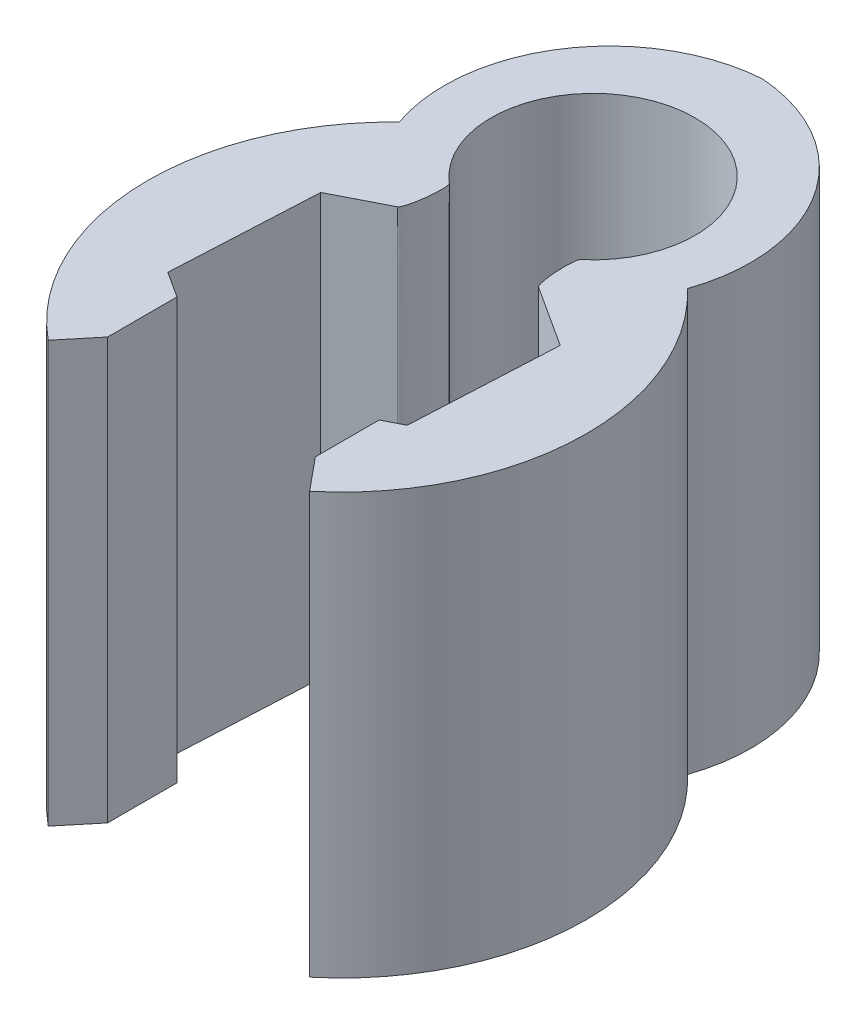
from build123d import *

# Parameters (mm, degrees)
BOSS_EXTRUDE1_DEPTH = 19.05


with BuildPart() as part:
    # Sketch3 → Boss-Extrude1 (new body)
    with BuildSketch(Plane(origin=(0, 0, 0), x_dir=(1, 0, 0), z_dir=(0, 1, 0))):
        with BuildLine():
            Line((-5.541525375, 3.58326618), (-2.47962532, 5.150959008))
            Line((-2.47962532, 5.150959008), (-2.47962532, 6.474170352))
            ThreePointArc((-2.47962532, 6.474170352), (-2.221563685, 14.417025562), (4.617359972, 10.369227654))
            ThreePointArc((4.617359972, 10.369227654), (4.047797908, 8.147663968), (2.47962532, 6.474170352))
            Line((2.47962532, 6.474170352), (2.47962532, 5.20231788))
            Line((2.47962532, 5.20231788), (5.873962228, 3.007468661))
            Line((5.873962228, 3.007468661), (5.541525375, -3.58326618))
            Line((5.541525375, -3.58326618), (4.701204968, -4.013510228))
            Line((4.701204968, -4.013510228), (4.701204968, -6.905610932))
            Line((4.701204968, -6.905610932), (5.918780254, -8.378526195))
            ThreePointArc((5.918780254, -8.378526195), (9.922634137, -0.265088751), (6.526624698, 8.120961152))
            ThreePointArc((6.526624698, 8.120961152), (5.706991897, 14.686716316), (0, 18.035026682))
            ThreePointArc((0, 18.035026682), (-5.706991897, 14.686716316), (-6.526624698, 8.120961152))
            ThreePointArc((-6.526624698, 8.120961152), (-9.922634137, -0.265088751), (-5.918780254, -8.378526195))
            Line((-5.918780254, -8.378526195), (-4.701204968, -6.905610932))
            Line((-4.701204968, -6.905610932), (-4.701204968, -3.765798027))
            Line((-4.701204968, -3.765798027), (-5.873962228, -3.007468661))
            Line((-5.873962228, -3.007468661), (-5.541525375, 3.58326618))
        make_face()
        with BuildLine():
            Line((-2.47962532, 6.474170352), (-2.47962532, 5.150959008))
            Line((-2.47962532, 5.150959008), (-1.063503338, 5.876013463))
            ThreePointArc((-1.063503338, 5.876013463), (-1.79663243, 6.115743784), (-2.47962532, 6.474170352))
        make_face()
        with BuildLine():
            ThreePointArc((2.47962532, 6.474170352), (1.921985685, 6.17089654), (1.328021538, 5.946968965))
            Line((1.328021538, 5.946968965), (2.47962532, 5.20231788))
            Line((2.47962532, 5.20231788), (2.47962532, 6.474170352))
        make_face()
    extrude(amount=BOSS_EXTRUDE1_DEPTH)

    # Fillet6
    # a fillet whose section is not a circle: 1.27 mm, written as the material it takes off along each edge
    with BuildSketch(Plane(origin=(1.328021538, -5.283304691, -5.946968965), x_dir=(0.8397378391322112, 0, 0.5429920455490709), z_dir=(0, 1, 0))) as fillet6_piece_1:
        with BuildLine():
            Bezier((2.113321876, 0), (0.3966534, 0), (0.898889741, 1.641556979), weights=[1, 0.118948346, 1])
            ThreePointArc((0.898889741, 1.641556979), (0.533488386, 0.774757636), (0, 0))
            Line((0, 0), (2.113321876, 0))
        make_face()
    extrude(amount=29.616609382, mode=Mode.SUBTRACT)
    with BuildSketch(Plane(origin=(-1.063503338, -6.120582224, -5.876013463), x_dir=(-0.891835980226881, 0, -0.4523589110128793), z_dir=(0, 1, 0))) as fillet6_piece_2:
        with BuildLine():
            Bezier((2.168149873, 0), (0.323600022, 0.445521101), (1.438773255, 1.980852292), weights=[1, 0.11123936, 1])
            Line((1.438773255, 1.980852292), (0, 0))
            ThreePointArc((0, 0), (1.084074937, 0.129064678), (2.168149873, 0))
        make_face()
    extrude(amount=31.291164449, mode=Mode.SUBTRACT)


solid = part.part
